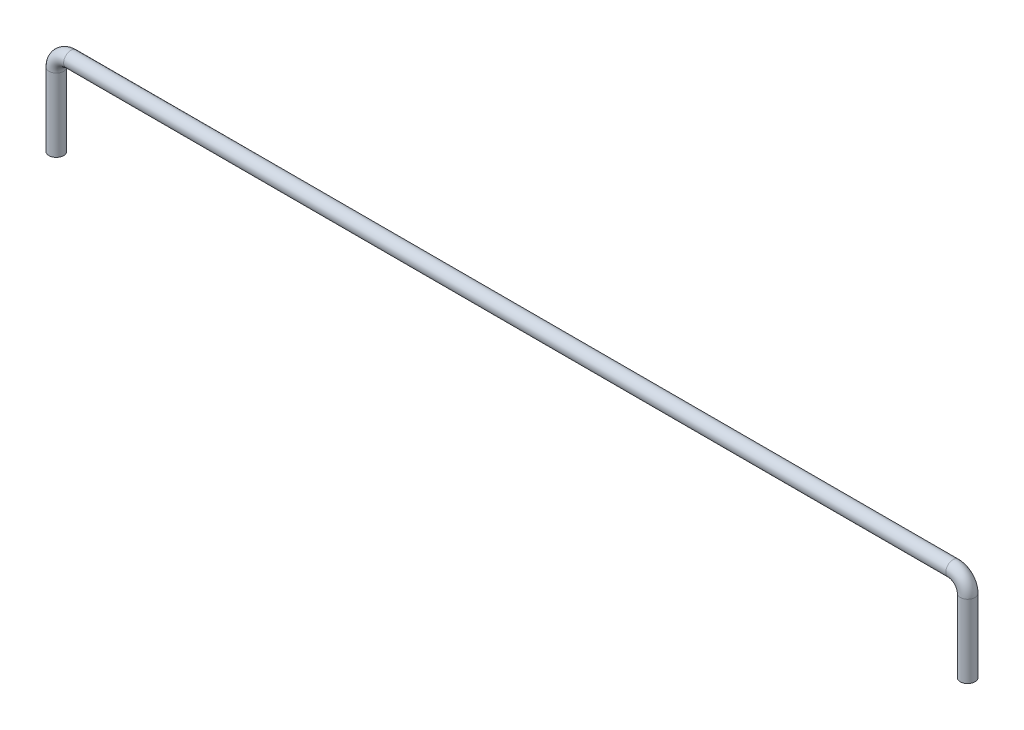
from build123d import *

# Parameters (mm, degrees)
SKETCH1_R           = 0.25
BOSS_EXTRUDE1_DEPTH = 2
SWEEP1_OUTLINE_R    = 0.25
SWEEP1_DEPTH        = 2.5
SWEEP1_2_OUTLINE_R  = 0.25
SWEEP1_2_ANGLE      = 90
SWEEP1_3_OUTLINE_R  = 0.25
SWEEP1_3_ANGLE      = 90
SWEEP1_START        = 0.4999999
SWEEP1_4_OUTLINE_R  = 0.25
SWEEP1_4_DEPTH      = 30.2000002


with BuildPart() as part:
    # Sketch1 → Boss-Extrude1 (new body)
    with BuildSketch(Plane(origin=(0, 0, 0), x_dir=(1, 0, 0), z_dir=(0, 1, 0))):
        with Locations(Location((0, 0, 0), (0, 0, 270))):
            Circle(SKETCH1_R)
    extrude(amount=BOSS_EXTRUDE1_DEPTH)

    # Sweep1: read off the stored shape, not the designer's step
    # Sweep1 outline → Sweep1 (add)
    with BuildSketch(Plane(origin=(0, 0, 0), x_dir=(1, 0, 0), z_dir=(0, 1, 0))):
        Circle(SWEEP1_OUTLINE_R)
        with Locations((31.2, 0)):
            Circle(SWEEP1_OUTLINE_R)
    extrude(amount=SWEEP1_DEPTH)

    # Sweep1 2 outline → Sweep1 2 (revolve)
    with BuildSketch(Plane(origin=(0.5, 2.5, 0), x_dir=(0, 1, 0), z_dir=(1, 0, 0))):
        with Locations((0.5, 0)):
            Circle(SWEEP1_2_OUTLINE_R)
    revolve(axis=Axis((0.5, 2.5, 0), (0, 0, 1)), revolution_arc=SWEEP1_2_ANGLE)

    # Sweep1 3 outline → Sweep1 3 (revolve)
    with BuildSketch(Plane(origin=(30.7, 2.5, 0), x_dir=(1, 0, 0), z_dir=(0, -1, 0))):
        with Locations((0.5, 0)):
            Circle(SWEEP1_3_OUTLINE_R)
    revolve(axis=Axis((30.7, 2.5, 0), (0, 0, 1)), revolution_arc=SWEEP1_3_ANGLE)

    # Sweep1 4 outline → Sweep1 4 (add)
    with BuildSketch(Plane.YZ.offset(SWEEP1_START)):
        with Locations((3, 0)):
            Circle(SWEEP1_4_OUTLINE_R)
    extrude(amount=SWEEP1_4_DEPTH)


solid = part.part
